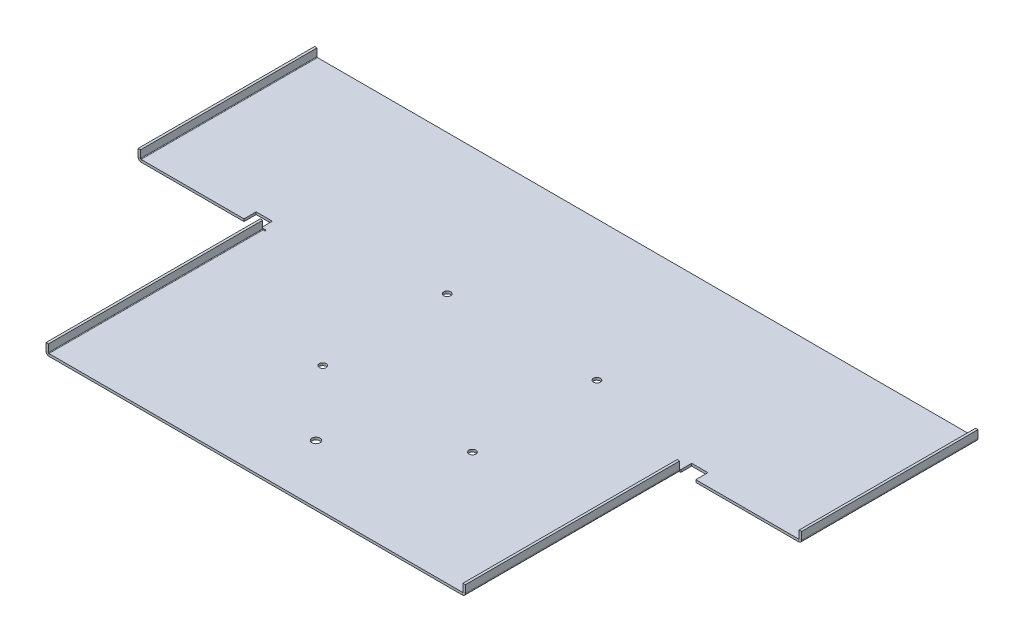
from build123d import *

# Parameters (mm, degrees)
SM_BASE_FLANGE_1_DEPTH   = 3
SM_START                 = 216.5
SM_EDGE_FLANGE_1_DEPTH   = 266.233197448
SM_EDGE_FLANGE_1_2_DEPTH = 216.5
SM_START_2               = 218
SM_EDGE_FLANGE_1_3_DEPTH = 264.733197448
SM_EDGE_FLANGE_1_4_DEPTH = 218
SM_START_3               = -1
SM_EDGE_FLANGE_1_5_DEPTH = 4.74
SKETCH_14_R              = 5
SKETCH_14_R_2            = 4.25
CUT_EXTRUDE_1_DEPTH      = 10


with BuildPart() as part:
    # Базовая кромка1: sheet metal written as solids
    # Sketch 1 → Базовая кромка1 (new body)
    with BuildSketch(Plane(origin=(0, 0, 0), x_dir=(1, 0, 0), z_dir=(0, 1, 0))):
        Polygon((-410, 0), (0, 0), (0, -482.733197448), (-259.163690552, -482.733197448), (-259.163690552, -203), (-279.163690552, -203), (-279.163690552, -218), (-410, -218), align=None)
    extrude(amount=SM_BASE_FLANGE_1_DEPTH)

    # Ребро-кромка1: read off the stored shape, not the designer's step
    # Ребро-кромка1 outline → Ребро-кромка1 (cut)
    with BuildSketch(Plane.XY.offset(SM_START)):
        with BuildLine():
            ThreePointArc((-255.423690552, 0), (-257.792234409, 0.845591597), (-259.089751108, 3))
            Line((-259.089751108, 3), (-259.163690552, 3))
            Line((-259.163690552, 3), (-259.163690552, 0))
            Line((-259.163690552, 0), (-255.423690552, 0))
        make_face()
        with BuildLine():
            Line((-410, 0), (-406.26, 0))
            ThreePointArc((-406.26, 0), (-408.628543857, 0.845591597), (-409.926060556, 3))
            Line((-409.926060556, 3), (-410, 3))
            Line((-410, 3), (-410, 0))
        make_face()
    extrude(amount=SM_EDGE_FLANGE_1_DEPTH, mode=Mode.SUBTRACT)

    # Sm Edge Flange 1 2 outline → Sm Edge Flange 1 2 (cut)
    with BuildSketch(Plane.XY):
        with BuildLine():
            Line((-410, 0), (-406.26, 0))
            ThreePointArc((-406.26, 0), (-408.628543857, 0.845591597), (-409.926060556, 3))
            Line((-409.926060556, 3), (-410, 3))
            Line((-410, 3), (-410, 0))
        make_face()
    extrude(amount=SM_EDGE_FLANGE_1_2_DEPTH, mode=Mode.SUBTRACT)

    # Sm Edge Flange 1 3 outline → Sm Edge Flange 1 3 (add)
    with BuildSketch(Plane.XY.offset(SM_START_2)):
        with BuildLine():
            Line((-259.163690552, 13), (-259.163690552, 3.74))
            ThreePointArc((-259.163690552, 3.74), (-259.145159783, 3.368157614), (-259.089751108, 3))
            Line((-259.089751108, 3), (-255.423690552, 3))
            ThreePointArc((-255.423690552, 3), (-255.94694957, 3.216740982), (-256.163690552, 3.74))
            Line((-256.163690552, 3.74), (-256.163690552, 13))
            Line((-256.163690552, 13), (-259.163690552, 13))
        make_face()
    extrude(amount=SM_EDGE_FLANGE_1_3_DEPTH)

    # Sm Edge Flange 1 4 outline → Sm Edge Flange 1 4 (add)
    with BuildSketch(Plane.XY):
        with BuildLine():
            Line((-409.926060556, 3), (-406.26, 3))
            ThreePointArc((-406.26, 3), (-406.783259018, 3.216740982), (-407, 3.74))
            Line((-407, 3.74), (-407, 13))
            Line((-407, 13), (-410, 13))
            Line((-410, 13), (-410, 3.74))
            ThreePointArc((-410, 3.74), (-409.981469231, 3.368157614), (-409.926060556, 3))
        make_face()
    extrude(amount=SM_EDGE_FLANGE_1_4_DEPTH)

    # Sm Edge Flange 1 5 outline → Sm Edge Flange 1 5 (cut)
    with BuildSketch(Plane(origin=(0, 0, 0), x_dir=(1, 0, 0), z_dir=(0, 1, 0)).offset(SM_START_3)):
        with BuildLine():
            Line((-260, -218), (-253.923690552, -218))
            ThreePointArc((-253.923690552, -218), (-253.173690552, -217.25), (-253.923690552, -216.5))
            Line((-253.923690552, -216.5), (-260, -216.5))
            Line((-260, -216.5), (-260, -218))
        make_face()
    extrude(amount=SM_EDGE_FLANGE_1_5_DEPTH, mode=Mode.SUBTRACT)

    # Зеркальное отражение1: part across plane


with BuildPart() as part_1:
    add(part.part)
    add(part.part.mirror(Plane(origin=(0, 3, 0), x_dir=(0, 0, 1), z_dir=(-1, 0, 0))))

    # Эскиз14 → Вырез-Вытянуть1 (cut)
    with BuildSketch(Plane(origin=(0, 3, 0), x_dir=(1, 0, 0), z_dir=(0, 1, 0))):
        with Locations(Location((2.5, -410.733197448, 0), (0, 0, 270))):
            Circle(SKETCH_14_R)
        with Locations(Location((111.6195, -172.648893261, 0), (0, 0, 270))):
            Circle(SKETCH_14_R_2)
        with Locations(Location((111.6195, -326.461239213, 0), (0, 0, 270))):
            Circle(SKETCH_14_R_2)
        with Locations(Location((-73.3805, -326.461239213, 0), (0, 0, 270))):
            Circle(SKETCH_14_R_2)
        with Locations(Location((-73.3805, -172.648893261, 0), (0, 0, 270))):
            Circle(SKETCH_14_R_2)
    extrude(amount=-CUT_EXTRUDE_1_DEPTH, mode=Mode.SUBTRACT)


solid = part_1.part
